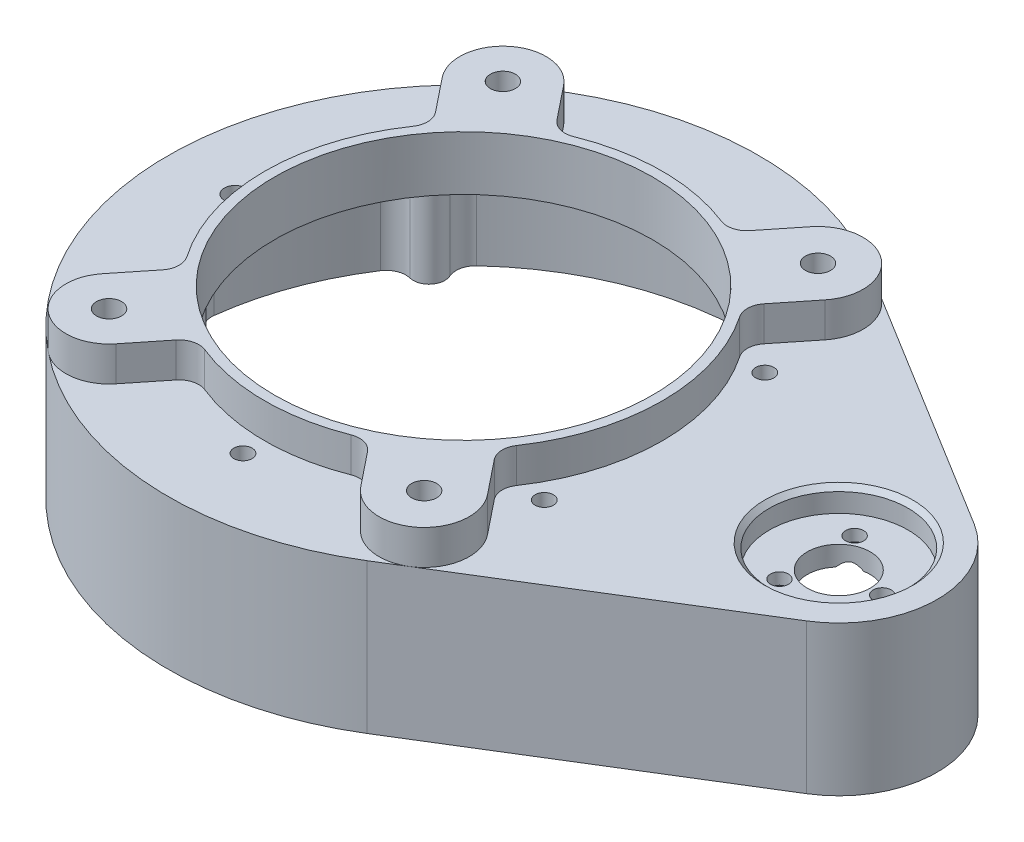
from build123d import *
from build123d.topology import SkipClean

# Parameters (mm, degrees)
SKETCH1_R                                         = 47.625
BOSS_EXTRUDE1_DEPTH                               = 24.13
SKETCH2_R                                         = 46.0375
CUT_EXTRUDE1_DEPTH                                = 20.955
SKETCH3_R                                         = 30.48
CUT_EXTRUDE2_DEPTH                                = 71.536467696
BOSS_EXTRUDE2_START                               = -24.13
BOSS_EXTRUDE2_DEPTH                               = 24.13
CUT_EXTRUDE3_DEPTH                                = 20.955
BOSS_EXTRUDE3_START                               = 3.81
BOSS_EXTRUDE3_DEPTH                               = 3.81
SKETCH7_R                                         = 11.176
CUT_EXTRUDE4_DEPTH                                = 3.81
CHAMFER1_SIZE                                     = 0.762
SKETCH8_R                                         = 5.08
CUT_EXTRUDE5_DEPTH                                = 93.274651762
CSK_FOR_M2_5_FLAT_HEAD_MACHINE_SCREW1_D           = 2.9
CSK_FOR_M2_5_FLAT_HEAD_MACHINE_SCREW1_CSINK_D     = 5.5
CSK_FOR_M2_5_FLAT_HEAD_MACHINE_SCREW1_CSINK_ANGLE = 90
CIRPATTERN1_COUNT                                 = 3
BOSS_EXTRUDE4_DEPTH                               = 5.588
SKETCH12_R                                        = 32.0675
SKETCH12_R_2                                      = 30.48
BOSS_EXTRUDE5_DEPTH                               = 5.588
FILLET2_R                                         = 3.175
F_10_32_TAPPED_HOLE1_D                            = 4.0386
CIRPATTERN2_COUNT                                 = 6
BOSS_EXTRUDE6_REACH                               = 96.789
SKETCH19_R                                        = 2.54
FILLET3_R                                         = 3.175
F_2_56_TAPPED_HOLE1_D                             = 1.778
F_2_56_TAPPED_HOLE1_DEPTH                         = 5.588
F_2_56_TAPPED_HOLE1_TIP                           = 0.53416509
BOSS_EXTRUDE7_DEPTH                               = 3.81
FILLET4_START                                     = 17.145
FILLET4_DEPTH                                     = 4.855
CUT_EXTRUDE6_START                                = 3.81
SKETCH27_R                                        = 11.176
CUT_EXTRUDE6_DEPTH                                = 3.81
F_8_32_TAPPED_HOLE1_D                             = 3.4544
F_8_32_TAPPED_HOLE1_DEPTH                         = 10.668
F_8_32_TAPPED_HOLE1_TIP                           = 1.037806461


with BuildPart() as part:
    # Sketch1 → Boss-Extrude1 (new body)
    with BuildSketch(Plane(origin=(0, 0, 0), x_dir=(1, 0, 0), z_dir=(0, 1, 0))):
        with Locations(Location((0, 0, 0), (0, 0, 90))):
            Circle(SKETCH1_R)
    extrude(amount=BOSS_EXTRUDE1_DEPTH)

    # Sketch2 → Cut-Extrude1 (cut)
    with BuildSketch(Plane.XZ):
        with Locations(Location((0, 0, 0), (0, 0, 270))):
            Circle(SKETCH2_R)
    extrude(amount=-CUT_EXTRUDE1_DEPTH, mode=Mode.SUBTRACT)

    # Sketch3 → Cut-Extrude2 (cut, through all)
    with BuildSketch(Plane.XZ.offset(-20.955)):
        with Locations(Location((0, 0, 0), (0, 0, 270))):
            Circle(SKETCH3_R)
    extrude(amount=-CUT_EXTRUDE2_DEPTH, mode=Mode.SUBTRACT)

    # Sketch4 → Boss-Extrude2 (add)
    with BuildSketch(Plane(origin=(0, 24.13, 0), x_dir=(1, 0, 0), z_dir=(0, 1, 0)).offset(BOSS_EXTRUDE2_START)):
        with BuildLine():
            Line((24.992128463, 40.540524662), (68.833509488, 13.513508221))
            ThreePointArc((68.833509488, 13.513508221), (76.3778, 0), (68.833509488, -13.513508221))
            Line((68.833509488, -13.513508221), (24.992128463, -40.540524662))
            ThreePointArc((24.992128463, -40.540524662), (47.625, 0), (24.992128463, 40.540524662))
        make_face()
    extrude(amount=BOSS_EXTRUDE2_DEPTH)

    # Sketch5 → Cut-Extrude3 (cut)
    with BuildSketch(Plane.XZ):
        with BuildLine():
            Line((24.159057515, -39.18917384), (68.000438539, -12.162157399))
            ThreePointArc((68.000438539, -12.162157399), (74.7903, 0), (68.000438539, 12.162157399))
            Line((68.000438539, 12.162157399), (24.159057515, 39.18917384))
            ThreePointArc((24.159057515, 39.18917384), (46.0375, 0), (24.159057515, -39.18917384))
        make_face()
    extrude(amount=-CUT_EXTRUDE3_DEPTH, mode=Mode.SUBTRACT)

    # Sketch6 → Boss-Extrude3 (add)
    with BuildSketch(Plane.XZ.offset(-20.955).offset(BOSS_EXTRUDE3_START)):
        with BuildLine():
            Line((53.258941455, 21.24988855), (46.079748027, 25.675665619))
            Line((46.079748027, 25.675665619), (46.912818976, 27.027016441))
            Line((46.912818976, 27.027016441), (68.833509488, 13.513508221))
            ThreePointArc((68.833509488, 13.513508221), (76.3778, 0), (68.833509488, -13.513508221))
            Line((68.833509488, -13.513508221), (46.912818976, -27.027016441))
            Line((46.912818976, -27.027016441), (46.079748027, -25.675665619))
            Line((46.079748027, -25.675665619), (53.258941455, -21.24988855))
            ThreePointArc((53.258941455, -21.24988855), (56.275621361, -15.959201965), (53.45203844, -10.562990174))
            ThreePointArc((53.45203844, -10.562990174), (47.8028, 0), (53.45203844, 10.562990174))
            ThreePointArc((53.45203844, 10.562990174), (56.275621361, 15.959201965), (53.258941455, 21.24988855))
        make_face()
    extrude(amount=-BOSS_EXTRUDE3_DEPTH)

    # Sketch7 → Cut-Extrude4 (cut)
    with BuildSketch(Plane(origin=(0, 24.13, 0), x_dir=(1, 0, 0), z_dir=(0, 1, 0))):
        with Locations(Location((60.5028, 0, 0), (0, 0, 270))):
            Circle(SKETCH7_R)
    extrude(amount=-CUT_EXTRUDE4_DEPTH, mode=Mode.SUBTRACT)

    # Chamfer1
    chamfer1_edges = [part.edges().sort_by_distance(p)[0] for p in [
        (60.5028, 24.13, -11.176),
    ]]
    chamfer(chamfer1_edges, length=CHAMFER1_SIZE)

    # Sketch8 → Cut-Extrude5 (cut, through all)
    with BuildSketch(Plane(origin=(0, 20.32, 0), x_dir=(1, 0, 0), z_dir=(0, 1, 0))):
        with Locations(Location((60.5028, 0, 0), (0, 0, 270))):
            Circle(SKETCH8_R)
    extrude(amount=-CUT_EXTRUDE5_DEPTH, mode=Mode.SUBTRACT)

    # CSK for M2.5 Flat Head Machine Screw1 (through all)
    with Locations(Plane.XZ.offset(-17.145)):
        with Locations((67.5028, 0)):
            csk_for_m2_5_flat_head_machine_screw1 = CounterSinkHole(CSK_FOR_M2_5_FLAT_HEAD_MACHINE_SCREW1_D / 2, CSK_FOR_M2_5_FLAT_HEAD_MACHINE_SCREW1_CSINK_D / 2, counter_sink_angle=CSK_FOR_M2_5_FLAT_HEAD_MACHINE_SCREW1_CSINK_ANGLE)

    # CirPattern1: CSK for M2.5 Flat Head Machine Screw1 ×3 about axis
    cirpattern1_axis = Axis((60.5028, 0, 0), (0, 1, 0))
    for i in range(1, CIRPATTERN1_COUNT):
        add(csk_for_m2_5_flat_head_machine_screw1.rotate(cirpattern1_axis, i * 360 / CIRPATTERN1_COUNT), mode=Mode.SUBTRACT)

    # Sketch11 → Boss-Extrude4 (add)
    with BuildSketch(Plane(origin=(0, 24.13, 0), x_dir=(1, 0, 0), z_dir=(0, 1, 0))):
        with BuildLine():
            Line((-30.83887705, 27.39889836), (-23.975769003, 18.820013302))
            ThreePointArc((-23.975769003, 18.820013302), (-19.040705049, 23.800881312), (-13.098014904, 27.522216582))
            Line((-13.098014904, 27.522216582), (-19.96112295, 36.10110164))
            ThreePointArc((-19.96112295, 36.10110164), (-29.75110164, 37.18887705), (-30.83887705, 27.39889836))
        make_face()
        with BuildLine():
            Line((19.723983021, 36.290813583), (12.815317769, 27.654982019))
            ThreePointArc((12.815317769, 27.654982019), (19.040705049, 23.800881312), (24.167351728, 18.573354852))
            Line((24.167351728, 18.573354852), (31.076016979, 27.209186417))
            ThreePointArc((31.076016979, 27.209186417), (29.940813583, 37.426016979), (19.723983021, 36.290813583))
        make_face()
    boss_extrude4 = extrude(amount=BOSS_EXTRUDE4_DEPTH)

    # Mirror1: Boss-Extrude4 across plane
    with SkipClean():  # the faces are left unmerged after this step: merging them gives an invalid solid
        add(boss_extrude4.mirror(Plane.XY))

    # Sketch12 → Boss-Extrude5 (add)
    with BuildSketch(Plane(origin=(0, 24.13, 0), x_dir=(1, 0, 0), z_dir=(0, 1, 0))):
        Circle(SKETCH12_R)
        with Locations(Location((0, 0, 0), (0, 0, 90))):
            Circle(SKETCH12_R_2, mode=Mode.SUBTRACT)
    extrude(amount=BOSS_EXTRUDE5_DEPTH)

    # Fillet2
    fillet2_edges = [part.edges().sort_by_distance(p)[0] for p in [
        (-24.993040349, 26.924, 20.091602484),
        (-14.115286249, 26.924, 28.793805764),
        (13.834964539, 26.924, 28.929540481),
        (25.186998497, 26.924, 19.847913315),
        (25.186998497, 26.924, -19.847913315),
        (13.834964539, 26.924, -28.929540481),
        (-14.115286249, 26.924, -28.793805764),
        (-24.993040349, 26.924, -20.091602484),
    ]]
    fillet(fillet2_edges, radius=FILLET2_R)

    # #10-32 Tapped Hole1 (through all)
    with Locations(Plane(origin=(0, 29.718, 0), x_dir=(-1, 0, 0), z_dir=(0, 1, 0))):
        with Locations((25.4, -31.75), (-25.4, -31.75), (25.4, 31.75), (-25.4, 31.75)):
            Hole(F_10_32_TAPPED_HOLE1_D / 2)

    # Sketch17 → #4 Clearance Hole1 (revolve, cut)
    with BuildSketch(Plane(origin=(0, 24.13, -35.56), x_dir=(0, 0, 1), z_dir=(1, 0, 0))):
        Polygon((0, 0), (0, 83.943187864), (1.4732, 83.058), (1.4732, 0), align=None)
    f_4_clearance_hole1 = revolve(axis=Axis((0, 30.48, -35.56), (0, -1, 0)), mode=Mode.SUBTRACT)

    # CirPattern2: #4 Clearance Hole1 ×6 about axis
    cirpattern2_axis = Axis((0, 0, 0), (0, 1, 0))
    for i in range(1, CIRPATTERN2_COUNT):
        add(f_4_clearance_hole1.rotate(cirpattern2_axis, i * 360 / CIRPATTERN2_COUNT), mode=Mode.SUBTRACT)

    # Boss-Extrude6: up to this face of the body (flat: up to its plane)
    boss_extrude6_end = Plane(part.part.faces().sort_by_distance((-44.661055577, 20.955, 0))[0])
    # Sketch19 → Boss-Extrude6 (add, up to the picked face)
    with BuildSketch(Plane.XZ, mode=Mode.PRIVATE) as boss_extrude6_sk1:
        with Locations((-45.085, 0)):
            Circle(SKETCH19_R)
    boss_extrude6_tool1 = split(extrude(boss_extrude6_sk1.sketch, amount=-BOSS_EXTRUDE6_REACH, mode=Mode.PRIVATE), bisect_by=boss_extrude6_end, keep=Keep.BOTH, mode=Mode.PRIVATE)
    # Sketch19 → Boss-Extrude6 (add, up to the picked face)
    with BuildSketch(Plane.XZ, mode=Mode.PRIVATE) as boss_extrude6_sk2:
        with Locations((-34.537113718, 28.980079383)):
            Circle(SKETCH19_R)
    boss_extrude6_tool2 = split(extrude(boss_extrude6_sk2.sketch, amount=-BOSS_EXTRUDE6_REACH, mode=Mode.PRIVATE), bisect_by=boss_extrude6_end, keep=Keep.BOTH, mode=Mode.PRIVATE)
    # Sketch19 → Boss-Extrude6 (add, up to the picked face)
    with BuildSketch(Plane.XZ, mode=Mode.PRIVATE) as boss_extrude6_sk3:
        with Locations((66.805805897, 11.779666048)):
            Circle(SKETCH19_R)
    boss_extrude6_tool3 = split(extrude(boss_extrude6_sk3.sketch, amount=-BOSS_EXTRUDE6_REACH, mode=Mode.PRIVATE), bisect_by=boss_extrude6_end, keep=Keep.BOTH, mode=Mode.PRIVATE)
    # Sketch19 → Boss-Extrude6 (add, up to the picked face)
    with BuildSketch(Plane.XZ, mode=Mode.PRIVATE) as boss_extrude6_sk4:
        with Locations((22.5425, 39.04475533)):
            Circle(SKETCH19_R)
    boss_extrude6_tool4 = split(extrude(boss_extrude6_sk4.sketch, amount=-BOSS_EXTRUDE6_REACH, mode=Mode.PRIVATE), bisect_by=boss_extrude6_end, keep=Keep.BOTH, mode=Mode.PRIVATE)
    # Sketch19 → Boss-Extrude6 (add, up to the picked face)
    with BuildSketch(Plane.XZ, mode=Mode.PRIVATE) as boss_extrude6_sk5:
        with Locations((66.805805897, -11.779666048)):
            Circle(SKETCH19_R)
    boss_extrude6_tool5 = split(extrude(boss_extrude6_sk5.sketch, amount=-BOSS_EXTRUDE6_REACH, mode=Mode.PRIVATE), bisect_by=boss_extrude6_end, keep=Keep.BOTH, mode=Mode.PRIVATE)
    # Sketch19 → Boss-Extrude6 (add, up to the picked face)
    with BuildSketch(Plane.XZ, mode=Mode.PRIVATE) as boss_extrude6_sk6:
        with Locations((22.5425, -39.04475533)):
            Circle(SKETCH19_R)
    boss_extrude6_tool6 = split(extrude(boss_extrude6_sk6.sketch, amount=-BOSS_EXTRUDE6_REACH, mode=Mode.PRIVATE), bisect_by=boss_extrude6_end, keep=Keep.BOTH, mode=Mode.PRIVATE)
    # Sketch19 → Boss-Extrude6 (add, up to the picked face)
    with BuildSketch(Plane.XZ, mode=Mode.PRIVATE) as boss_extrude6_sk7:
        with Locations((-34.537113718, -28.980079383)):
            Circle(SKETCH19_R)
    boss_extrude6_tool7 = split(extrude(boss_extrude6_sk7.sketch, amount=-BOSS_EXTRUDE6_REACH, mode=Mode.PRIVATE), bisect_by=boss_extrude6_end, keep=Keep.BOTH, mode=Mode.PRIVATE)
    add(boss_extrude6_tool1.solids().sort_by(Axis((-45.085, 0, 0), (0, 1, 0)))[0])
    add(boss_extrude6_tool2.solids().sort_by(Axis((-34.537114, 0, 28.980079), (0, 1, 0)))[0])
    add(boss_extrude6_tool3.solids().sort_by(Axis((66.805806, 0, 11.779666), (0, 1, 0)))[0])
    add(boss_extrude6_tool4.solids().sort_by(Axis((22.5425, 0, 39.044755), (0, 1, 0)))[0])
    add(boss_extrude6_tool5.solids().sort_by(Axis((66.805806, 0, -11.779666), (0, 1, 0)))[0])
    add(boss_extrude6_tool6.solids().sort_by(Axis((22.5425, 0, -39.044755), (0, 1, 0)))[0])
    add(boss_extrude6_tool7.solids().sort_by(Axis((-34.537114, 0, -28.980079), (0, 1, 0)))[0])

    # Fillet3
    fillet3_edges = [part.edges().sort_by_distance(p)[0] for p in [
        (-45.976012324, 10.4775, 2.378591398),
        (-45.976012324, 10.4775, -2.378591398),
        (-33.690739678, 10.4775, 31.374917788),
        (-36.748597837, 10.4775, 27.730704342),
        (69.29282254, 8.5725, 11.263576696),
        (65.301271282, 8.5725, 13.826120443),
        (20.928085586, 10.4775, 41.005690336),
        (25.050029359, 10.4775, 38.639913983),
        (65.301271282, 8.5725, -13.826120443),
        (69.29282254, 8.5725, -11.263576696),
        (25.050029359, 10.4775, -38.639913983),
        (20.928085586, 10.4775, -41.005690336),
        (-33.690739678, 10.4775, -31.374917788),
        (-36.748597837, 10.4775, -27.730704342),
    ]]
    fillet(fillet3_edges, radius=FILLET3_R)

    # #2-56 Tapped Hole1
    with Locations(Plane.XZ):
        with Locations((-34.537113718, 28.980079383), (22.5425, 39.04475533), (66.805805897, 11.779666048), (66.805805897, -11.779666048), (22.5425, -39.04475533), (-34.537113718, -28.980079383), (-45.085, 0)):
            Hole(F_2_56_TAPPED_HOLE1_D / 2, depth=F_2_56_TAPPED_HOLE1_DEPTH)
            with Locations((0, 0, -(F_2_56_TAPPED_HOLE1_DEPTH + F_2_56_TAPPED_HOLE1_TIP / 2))):  # 118° drill point
                Cone(0, F_2_56_TAPPED_HOLE1_D / 2, F_2_56_TAPPED_HOLE1_TIP, mode=Mode.SUBTRACT)

    # Sketch23 → Boss-Extrude7 (add)
    with BuildSketch(Plane.XZ.offset(-17.145)):
        with BuildLine():
            Line((47.8028, 0), (47.8028, 24.613451042))
            Line((47.8028, 24.613451042), (53.258941455, 21.24988855))
            ThreePointArc((53.258941455, 21.24988855), (56.275621361, 15.959201965), (53.45203844, 10.562990174))
            ThreePointArc((53.45203844, 10.562990174), (49.303811836, 5.989379275), (47.8028, 0))
        make_face()
    extrude(amount=-BOSS_EXTRUDE7_DEPTH)

    # Fillet4: read off the stored shape, not the designer's step
    # Fillet4 outline → Fillet4 (add)
    with BuildSketch(Plane(origin=(0, 0, 0), x_dir=(1, 0, 0), z_dir=(0, 1, 0)).offset(FILLET4_START)):
        with BuildLine():
            Line((47.8028, -24.613451042), (47.8028, -21.068387542))
            ThreePointArc((47.8028, -21.068387542), (46.997279331, -24.163746802), (44.785083795, -26.47379083))
            Line((44.785083795, -26.47379083), (47.8028, -24.613451042))
        make_face()
    extrude(amount=FILLET4_DEPTH)

    # Sketch27 → Cut-Extrude6 (cut)
    with BuildSketch(Plane(origin=(0, 20.32, 0), x_dir=(1, 0, 0), z_dir=(0, 1, 0)).offset(CUT_EXTRUDE6_START)):
        with Locations(Location((60.5028, 0, 0), (0, 0, 270))):
            Circle(SKETCH27_R)
    extrude(amount=-CUT_EXTRUDE6_DEPTH, mode=Mode.SUBTRACT)

    # #8-32 Tapped Hole1
    with Locations(Plane(origin=(0, 24.13, 0), x_dir=(-1, 0, 0), z_dir=(0, 1, 0))):
        with Locations((36.83, 0)):
            Hole(F_8_32_TAPPED_HOLE1_D / 2, depth=F_8_32_TAPPED_HOLE1_DEPTH)
            with Locations((0, 0, -(F_8_32_TAPPED_HOLE1_DEPTH + F_8_32_TAPPED_HOLE1_TIP / 2))):  # 118° drill point
                Cone(0, F_8_32_TAPPED_HOLE1_D / 2, F_8_32_TAPPED_HOLE1_TIP, mode=Mode.SUBTRACT)


solid = part.part
